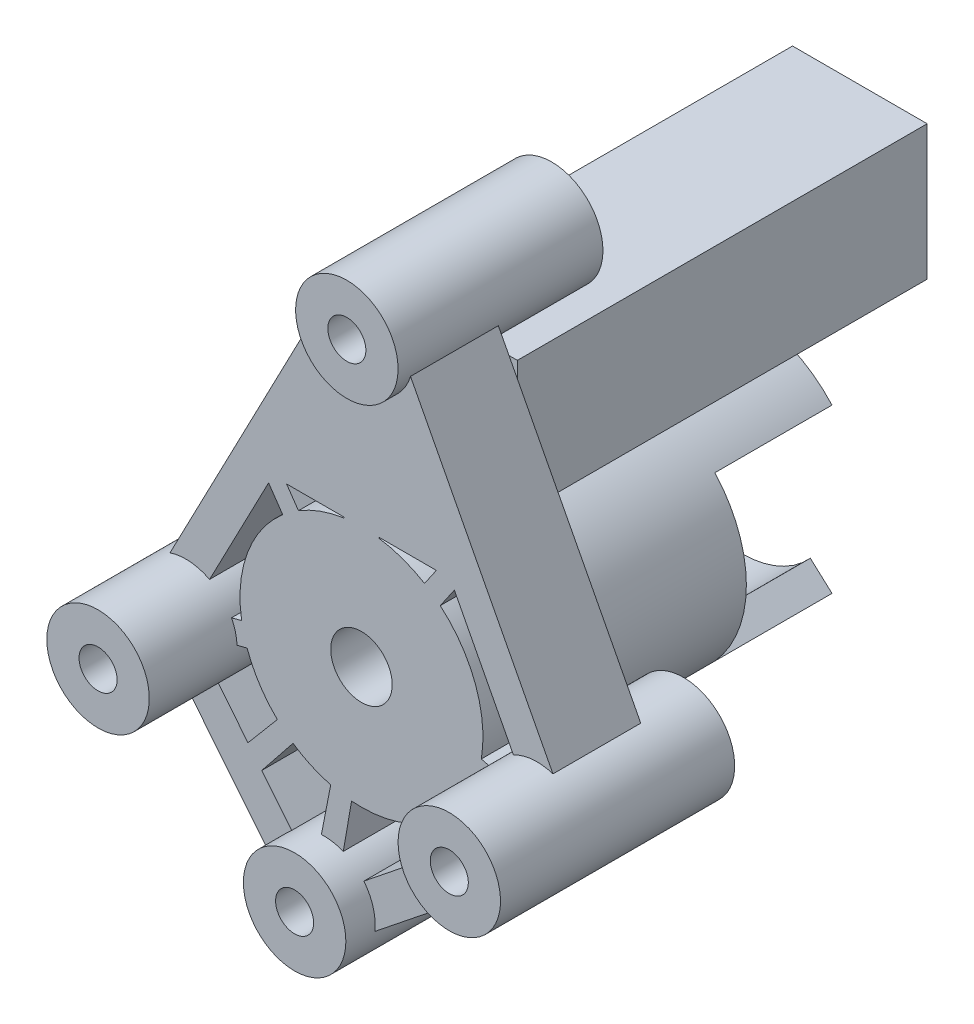
from build123d import *
from build123d.topology import SkipClean

# Parameters (mm, degrees)
SKETCH1_R                 = 0.6
SKETCH1_R_2               = 0.5
SKETCH1_R_3               = 1.05
BOSS_EXTRUDE7_DEPTH       = 3
BOSS_EXTRUDE8_DEPTH       = 3
BOSS_EXTRUDE13_DEPTH      = 3.5
BOSS_EXTRUDE13_DEPTH_BACK = 3.5
SKETCH3_R                 = 1.25
SKETCH3_R_2               = 0.6
BOSS_EXTRUDE14_START      = 2
SKETCH4_R                 = 3.497504757
SKETCH4_R_2               = 3.05
BOSS_EXTRUDE14_DEPTH      = 2
BOSS_EXTRUDE15_DEPTH      = 3
BOSS_EXTRUDE15_DEPTH_BACK = 5
SKETCH6_R                 = 1.25
SKETCH6_R_2               = 0.5
BOSS_EXTRUDE16_DEPTH      = 1
BOSS_EXTRUDE16_DEPTH_BACK = 5
SKETCH7_R                 = 1.25
SKETCH7_R_2               = 0.6
BOSS_EXTRUDE20_START      = -3
SKETCH10_R                = 3.839401525
SKETCH10_R_2              = 1.05
BOSS_EXTRUDE20_DEPTH      = 3
BOSS_EXTRUDE24_DEPTH      = 3.5
BOSS_EXTRUDE24_DEPTH_BACK = 3.5
SKETCH13_R                = 1.26
SKETCH13_R_2              = 0.6
BOSS_EXTRUDE25_START      = 4
SKETCH14_R                = 3.839401525
SKETCH14_R_2              = 3.05
BOSS_EXTRUDE25_DEPTH      = 4
SKETCH16_R                = 3.15
CUT_EXTRUDE1_DEPTH        = 10
SKETCH19_W                = 4.6
SKETCH19_H                = 4.6
SKETCH19_W_2              = 2.1
SKETCH19_H_2              = 2.1
BOSS_EXTRUDE30_DEPTH      = 14
BOSS_EXTRUDE31_DEPTH      = 3
BOSS_EXTRUDE32_DEPTH      = 6
BOSS_EXTRUDE32_DEPTH_BACK = 3
SKETCH21_R                = 4.15
SKETCH21_R_2              = 3.7
SKETCH23_R                = 0.65
SKETCH23_R_2              = 0.6
SKETCH23_R_3              = 0.5
CUT_EXTRUDE3_DEPTH        = 19.045223745
SKETCH24_R                = 1.75
SKETCH24_R_2              = 1.25
SKETCH24_R_3              = 1.26
BOSS_EXTRUDE34_DEPTH      = 8
SKETCH25_R                = 1.75
SKETCH25_R_2              = 1.26
BOSS_EXTRUDE35_DEPTH      = 2
CUT_EXTRUDE4_START        = -2.5
SKETCH28_R                = 1.75
SKETCH28_R_2              = 1.26
CUT_EXTRUDE4_DEPTH        = 2.5
SKETCH29_R                = 1.75
SKETCH29_R_2              = 1.25
CUT_EXTRUDE5_DEPTH        = 5.5
BOSS_EXTRUDE36_DEPTH      = 4


with BuildPart() as part:
    # Sketch1 → Boss-Extrude7 (new body)
    with BuildSketch(Plane.XY):
        with BuildLine():
            Line((7.108231058, 0.578207508), (1.108231058, 12.078207508))
            ThreePointArc((1.108231058, 12.078207508), (0, 12.75), (-1.108231058, 12.078207508))
            Line((-1.108231058, 12.078207508), (-7.108231058, 0.578207508))
            ThreePointArc((-7.108231058, 0.578207508), (-7.243810578, -0.124238663), (-6.971967562, -0.785989223))
            Line((-6.971967562, -0.785989223), (-2.256095038, -6.617716918))
            ThreePointArc((-2.256095038, -6.617716918), (-1.418670785, -7.074465841), (-0.502897209, -6.807524431))
            Line((-0.502897209, -6.807524431), (6.781230267, -0.975796736))
            ThreePointArc((6.781230267, -0.975796736), (7.223212296, -0.257394013), (7.108231058, 0.578207508))
        make_face()
        with BuildLine():
            Line((3.173462253, 5.417530683), (5.421792492, 1.108231058))
            ThreePointArc((5.421792492, 1.108231058), (5.151146176, 0.917576801), (4.940041034, 0.662560934))
            Line((4.940041034, 0.662560934), (3.460019455, 1.046730378))
            ThreePointArc((3.460019455, 1.046730378), (3.285676763, 2.756115163), (2.318317637, 4.176188415))
            Line((2.318317637, 4.176188415), (3.173462253, 5.417530683))
        make_face(mode=Mode.SUBTRACT)
        with BuildLine():
            Line((2.826537747, 6.082469317), (1.782346296, 4.56670349))
            ThreePointArc((1.782346296, 4.56670349), (1.213377036, 4.837703852), (0.605011738, 5.002199688))
            Line((0.605011738, 5.002199688), (0.593832634, 7.25))
            Line((0.593832634, 7.25), (-0.593832634, 7.25))
            Line((-0.593832634, 7.25), (-0.605011738, 5.002199688))
            ThreePointArc((-0.605011738, 5.002199688), (-1.213377036, 4.837703852), (-1.782346296, 4.56670349))
            Line((-1.782346296, 4.56670349), (-2.826537747, 6.082469317))
            Line((-2.826537747, 6.082469317), (-1.459602819, 8.702427929))
            Line((-1.459602819, 8.702427929), (-1.416591598, 10.248840282))
            Line((-1.416591598, 10.248840282), (-0.652452596, 10.249465858))
            Line((-0.652452596, 10.249465858), (-0.578207508, 10.391768942))
            ThreePointArc((-0.578207508, 10.391768942), (0, 10.25), (0.578207508, 10.391768942))
            Line((0.578207508, 10.391768942), (0.652452596, 10.249465858))
            Line((0.652452596, 10.249465858), (1.416591598, 10.248840282))
            Line((1.416591598, 10.248840282), (1.459602819, 8.702427929))
            Line((1.459602819, 8.702427929), (2.826537747, 6.082469317))
        make_face(mode=Mode.SUBTRACT)
        with Locations((0, 11.5)):
            Circle(SKETCH1_R, mode=Mode.SUBTRACT)
        with Locations((6, 0)):
            Circle(SKETCH1_R_2, mode=Mode.SUBTRACT)
        with BuildLine():
            Line((-5.421792492, 1.108231058), (-3.173462253, 5.417530683))
            Line((-3.173462253, 5.417530683), (-2.318317637, 4.176188415))
            ThreePointArc((-2.318317637, 4.176188415), (-3.285676763, 2.756115163), (-3.460019455, 1.046730378))
            Line((-3.460019455, 1.046730378), (-4.940041034, 0.662560934))
            ThreePointArc((-4.940041034, 0.662560934), (-5.151146176, 0.917576801), (-5.421792492, 1.108231058))
        make_face(mode=Mode.SUBTRACT)
        with BuildLine():
            Line((2.065197241, -3.150232928), (-0.30833074, -5.050497428))
            ThreePointArc((-0.30833074, -5.050497428), (-0.49210351, -4.864671318), (-0.710499145, -4.721119511))
            Line((-0.710499145, -4.721119511), (-0.225925805, -1.932779162))
            ThreePointArc((-0.225925805, -1.932779162), (0.553480724, -1.89601189), (1.305339934, -1.687363629))
            Line((1.305339934, -1.687363629), (2.065197241, -3.150232928))
        make_face(mode=Mode.SUBTRACT)
        with BuildLine():
            Line((5.024203264, -0.781230267), (2.650675283, -2.681494768))
            Line((2.650675283, -2.681494768), (1.955184546, -1.342543312))
            ThreePointArc((1.955184546, -1.342543312), (2.741798836, -0.614002206), (3.270756776, 0.318595072))
            Line((3.270756776, 0.318595072), (4.750934565, -0.048327426))
            ThreePointArc((4.750934565, -0.048327426), (4.828765795, -0.436704061), (5.024203264, -0.781230267))
        make_face(mode=Mode.SUBTRACT)
        with BuildLine():
            ThreePointArc((-1.930451643, -1.359065941), (-1.446591891, -1.626901774), (-0.926562281, -1.815118396))
            Line((-0.926562281, -1.815118396), (-1.468660161, -4.595423652))
            ThreePointArc((-1.468660161, -4.595423652), (-1.787065481, -4.687370512), (-2.070116699, -4.859760133))
            Line((-2.070116699, -4.859760133), (-3.406266971, -3.207454116))
            Line((-3.406266971, -3.207454116), (-1.930451643, -1.359065941))
        make_face(mode=Mode.SUBTRACT)
        with BuildLine():
            ThreePointArc((-3.270756776, 0.318595072), (-2.929706535, -0.352908606), (-2.452803504, -0.935828803))
            Line((-2.452803504, -0.935828803), (-3.877860505, -2.624273579))
            Line((-3.877860505, -2.624273579), (-5.214010777, -0.971967562))
            ThreePointArc((-5.214010777, -0.971967562), (-4.882574548, -0.560232416), (-4.750934565, -0.048327426))
            Line((-4.750934565, -0.048327426), (-3.270756776, 0.318595072))
        make_face(mode=Mode.SUBTRACT)
        with Locations((-6, 0)):
            Circle(SKETCH1_R_2, mode=Mode.SUBTRACT)
        with Locations((-1.284127476, -5.831727695)):
            Circle(SKETCH1_R, mode=Mode.SUBTRACT)
        with Locations((0, 1.557420984)):
            Circle(SKETCH1_R_3, mode=Mode.SUBTRACT)
    extrude(amount=BOSS_EXTRUDE7_DEPTH)

    # Sketch1<8> → Boss-Extrude8 (add)
    with BuildSketch(Plane.XY):
        with BuildLine():
            Line((0.652452596, 10.249465858), (0.578207508, 10.391768942))
            ThreePointArc((0.578207508, 10.391768942), (0, 10.25), (-0.578207508, 10.391768942))
            Line((-0.578207508, 10.391768942), (-0.652452596, 10.249465858))
            Line((-0.652452596, 10.249465858), (-1.416591598, 10.248840282))
            Line((-1.416591598, 10.248840282), (-1.459602819, 8.702427929))
            Line((-1.459602819, 8.702427929), (-2.217391304, 7.25))
            Line((-2.217391304, 7.25), (2.217391304, 7.25))
            Line((2.217391304, 7.25), (1.459602819, 8.702427929))
            Line((1.459602819, 8.702427929), (1.416591598, 10.248840282))
            Line((1.416591598, 10.248840282), (0.652452596, 10.249465858))
        make_face()
    extrude(amount=BOSS_EXTRUDE8_DEPTH)

    # Sketch4 → Boss-Extrude14 (add)
    with SkipClean():  # the faces are left unmerged after this step: merging them gives an invalid solid
        with BuildSketch(Plane(origin=(0, 0, 0), x_dir=(-1, 0, 0), z_dir=(0, 0, -1)).offset(BOSS_EXTRUDE14_START)):
            with Locations((0, 1.557420984)):
                Circle(SKETCH4_R)
            with Locations((0, 1.557420984)):
                Circle(SKETCH4_R_2, mode=Mode.SUBTRACT)
        extrude(amount=-BOSS_EXTRUDE14_DEPTH)

    # Sketch6 → Boss-Extrude15 (add, two sides: drawn at the far end of the back side and taken through both)
    # profile 1 of 2: a face of its own
    with SkipClean():  # the faces are left unmerged after this step: merging them gives an invalid solid
        with BuildSketch(Plane.XY.offset(3).offset(-BOSS_EXTRUDE15_DEPTH_BACK)):
            with Locations((-6, 0)):
                Circle(SKETCH6_R)
            with Locations((-6, 0)):
                Circle(SKETCH6_R_2, mode=Mode.SUBTRACT)
        # profile 2 of 2: a face of its own
        with BuildSketch(Plane.XY.offset(3).offset(-BOSS_EXTRUDE15_DEPTH_BACK)):
            with Locations((6, 0)):
                Circle(SKETCH6_R)
            with Locations((6, 0)):
                Circle(SKETCH6_R_2, mode=Mode.SUBTRACT)
        extrude(amount=BOSS_EXTRUDE15_DEPTH + BOSS_EXTRUDE15_DEPTH_BACK)

    # Sketch7 → Boss-Extrude16 (add, two sides: drawn at the far end of the back side and taken through both)
    with SkipClean():  # the faces are left unmerged after this step: merging them gives an invalid solid
        with BuildSketch(Plane.XY.offset(3).offset(-BOSS_EXTRUDE16_DEPTH_BACK)):
            with Locations((-1.284127476, -5.831727695)):
                Circle(SKETCH7_R)
            with Locations((-1.284127476, -5.831727695)):
                Circle(SKETCH7_R_2, mode=Mode.SUBTRACT)
        extrude(amount=BOSS_EXTRUDE16_DEPTH + BOSS_EXTRUDE16_DEPTH_BACK)

    # Sketch10 → Boss-Extrude20 (add)
    with SkipClean():  # the faces are left unmerged after this step: merging them gives an invalid solid
        with BuildSketch(Plane.XY.offset(3).offset(BOSS_EXTRUDE20_START)):
            with Locations((0, 1.557420984)):
                Circle(SKETCH10_R)
            with Locations((0, 1.557420984)):
                Circle(SKETCH10_R_2, mode=Mode.SUBTRACT)
        extrude(amount=BOSS_EXTRUDE20_DEPTH)



with BuildPart() as body_2:
    # Sketch3 → Boss-Extrude13 (new, two sides: drawn at the far end of the back side and taken through both)
    with BuildSketch(Plane(origin=(0, 0, 0), x_dir=(-1, 0, 0), z_dir=(0, 0, -1)).offset(-BOSS_EXTRUDE13_DEPTH_BACK)):
        with Locations((0, 11.5)):
            Circle(SKETCH3_R)
        with Locations((0, 11.5)):
            Circle(SKETCH3_R_2, mode=Mode.SUBTRACT)
    extrude(amount=BOSS_EXTRUDE13_DEPTH + BOSS_EXTRUDE13_DEPTH_BACK)


with BuildPart() as part_1:
    with SkipClean():  # the faces are left unmerged after this step: merging them gives an invalid solid
        add(part.part)

        add(body_2.part)  # Boss-Extrude24 merges body 2
        # Sketch13 → Boss-Extrude24 (add, two sides: drawn at the far end of the back side and taken through both)
        with BuildSketch(Plane(origin=(0, 0, 0), x_dir=(-1, 0, 0), z_dir=(0, 0, -1)).offset(-BOSS_EXTRUDE24_DEPTH_BACK)):
            with Locations((0, 11.5)):
                Circle(SKETCH13_R)
            with Locations((0, 11.5)):
                Circle(SKETCH13_R_2, mode=Mode.SUBTRACT)
        extrude(amount=BOSS_EXTRUDE24_DEPTH + BOSS_EXTRUDE24_DEPTH_BACK)

    # Sketch14 → Boss-Extrude25 (add)
    with SkipClean():  # the faces are left unmerged after this step: merging them gives an invalid solid
        with BuildSketch(Plane(origin=(0, 0, -2), x_dir=(-1, 0, 0), z_dir=(0, 0, -1)).offset(BOSS_EXTRUDE25_START)):
            with Locations((0, 1.557420984)):
                Circle(SKETCH14_R)
            with Locations((0, 1.557420984)):
                Circle(SKETCH14_R_2, mode=Mode.SUBTRACT)
        extrude(amount=-BOSS_EXTRUDE25_DEPTH)

    # Sketch16 → Cut-Extrude1 (cut)
    with SkipClean():  # the faces are left unmerged after this step: merging them gives an invalid solid
        with BuildSketch(Plane(origin=(0, 0, 0), x_dir=(-1, 0, 0), z_dir=(0, 0, -1))):
            with Locations((0, 1.557420984)):
                Circle(SKETCH16_R)
        extrude(amount=CUT_EXTRUDE1_DEPTH, mode=Mode.SUBTRACT)

    # Sketch19 → Boss-Extrude30 (add)
    with SkipClean():  # the faces are left unmerged after this step: merging them gives an invalid solid
        with BuildSketch(Plane(origin=(0, 0, 0), x_dir=(-1, 0, 0), z_dir=(0, 0, -1))):
            with Locations((-0.026819917, 7.993639834)):
                Rectangle(SKETCH19_W, SKETCH19_H)
            with Locations((0, 7.966819917)):
                Rectangle(SKETCH19_W_2, SKETCH19_H_2, mode=Mode.SUBTRACT)
        extrude(amount=BOSS_EXTRUDE30_DEPTH)

    # Sketch20 → Boss-Extrude31 (add)
    with SkipClean():  # the faces are left unmerged after this step: merging them gives an invalid solid
        with BuildSketch(Plane.XY.offset(3)):
            Polygon((0.593832634, 7.25), (0.601572962, 5.693639834), (2.558678151, 5.693639834), (2.826537747, 6.082469317), (2.217391304, 7.25), align=None)
            Polygon((-2.826537747, 6.082469317), (-2.558678151, 5.693639834), (-0.601572962, 5.693639834), (-0.593832634, 7.25), (-2.217391304, 7.25), align=None)
        extrude(amount=-BOSS_EXTRUDE31_DEPTH)

    # Sketch21 → Boss-Extrude32 (add, two sides: drawn at the far end of the back side and taken through both)
    with SkipClean():  # the faces are left unmerged after this step: merging them gives an invalid solid
        with BuildSketch(Plane(origin=(0, 0, 0), x_dir=(-1, 0, 0), z_dir=(0, 0, -1)).offset(-BOSS_EXTRUDE32_DEPTH_BACK)):
            with Locations((0, 1.557420984)):
                Circle(SKETCH21_R)
            with Locations((0, 1.557420984)):
                Circle(SKETCH21_R_2, mode=Mode.SUBTRACT)
        extrude(amount=BOSS_EXTRUDE32_DEPTH + BOSS_EXTRUDE32_DEPTH_BACK)

    # Sketch23 → Cut-Extrude3 (cut, through all)
    # profile 1 of 4: a face of its own
    with SkipClean():  # the faces are left unmerged after this step: merging them gives an invalid solid
        with BuildSketch(Plane(origin=(0, 0, -3.5), x_dir=(-1, 0, 0), z_dir=(0, 0, -1))):
            with Locations((0, 11.5)):
                Circle(SKETCH23_R)
            with Locations((0, 11.5)):
                Circle(SKETCH23_R_2, mode=Mode.SUBTRACT)
        # profile 2 of 4: a face of its own
        with BuildSketch(Plane(origin=(0, 0, -3.5), x_dir=(-1, 0, 0), z_dir=(0, 0, -1))):
            with Locations((-6, 0)):
                Circle(SKETCH23_R)
            with Locations((-6, 0)):
                Circle(SKETCH23_R_3, mode=Mode.SUBTRACT)
        # profile 3 of 4: a face of its own
        with BuildSketch(Plane(origin=(0, 0, -3.5), x_dir=(-1, 0, 0), z_dir=(0, 0, -1))):
            with Locations((1.284127476, -5.831727695)):
                Circle(SKETCH23_R)
            with Locations((1.284127476, -5.831727695)):
                Circle(SKETCH23_R_2, mode=Mode.SUBTRACT)
        # profile 4 of 4: a face of its own
        with BuildSketch(Plane(origin=(0, 0, -3.5), x_dir=(-1, 0, 0), z_dir=(0, 0, -1))):
            with Locations((6, 0)):
                Circle(SKETCH23_R)
            with Locations((6, 0)):
                Circle(SKETCH23_R_3, mode=Mode.SUBTRACT)
        extrude(amount=-CUT_EXTRUDE3_DEPTH, mode=Mode.SUBTRACT)

    # Sketch24 → Boss-Extrude34 (add)
    # profile 1 of 4: a face of its own
    with BuildSketch(Plane(origin=(0, 0, -2), x_dir=(-1, 0, 0), z_dir=(0, 0, -1))):
        with Locations((-6, 0)):
            Circle(SKETCH24_R)
        with Locations((-6, 0)):
            Circle(SKETCH24_R_2, mode=Mode.SUBTRACT)
    # profile 2 of 4: a face of its own
    with BuildSketch(Plane(origin=(0, 0, -2), x_dir=(-1, 0, 0), z_dir=(0, 0, -1))):
        with Locations((0, 11.5)):
            Circle(SKETCH24_R)
        with Locations((0, 11.5)):
            Circle(SKETCH24_R_3, mode=Mode.SUBTRACT)
    # profile 3 of 4: a face of its own
    with BuildSketch(Plane(origin=(0, 0, -2), x_dir=(-1, 0, 0), z_dir=(0, 0, -1))):
        with Locations((6, 0)):
            Circle(SKETCH24_R)
        with Locations((6, 0)):
            Circle(SKETCH24_R_2, mode=Mode.SUBTRACT)
    # profile 4 of 4: a face of its own
    with BuildSketch(Plane(origin=(0, 0, -2), x_dir=(-1, 0, 0), z_dir=(0, 0, -1))):
        with Locations((1.284127476, -5.831727695)):
            Circle(SKETCH24_R)
        with Locations((1.284127476, -5.831727695)):
            Circle(SKETCH24_R_2, mode=Mode.SUBTRACT)
    extrude(amount=-BOSS_EXTRUDE34_DEPTH)

    # Sketch25 → Boss-Extrude35 (add)
    with BuildSketch(Plane(origin=(0, 0, -3.5), x_dir=(-1, 0, 0), z_dir=(0, 0, -1))):
        with Locations((0, 11.5)):
            Circle(SKETCH25_R)
        with Locations((0, 11.5)):
            Circle(SKETCH25_R_2, mode=Mode.SUBTRACT)
    extrude(amount=-BOSS_EXTRUDE35_DEPTH)

    # Sketch28 → Cut-Extrude4 (cut)
    with BuildSketch(Plane.XY.offset(6).offset(CUT_EXTRUDE4_START)):
        with Locations((0, 11.5)):
            Circle(SKETCH28_R)
        with Locations((0, 11.5)):
            Circle(SKETCH28_R_2, mode=Mode.SUBTRACT)
    extrude(amount=CUT_EXTRUDE4_DEPTH, mode=Mode.SUBTRACT)

    # Sketch29 → Cut-Extrude5 (cut)
    with BuildSketch(Plane.XY.offset(4)):
        with Locations((-1.284127476, -5.831727695)):
            Circle(SKETCH29_R)
        with Locations((-1.284127476, -5.831727695)):
            Circle(SKETCH29_R_2, mode=Mode.SUBTRACT)
    extrude(amount=CUT_EXTRUDE5_DEPTH, mode=Mode.SUBTRACT)

    # Sketch30 → Boss-Extrude36 (add)
    with BuildSketch(Plane(origin=(0, 0, -6), x_dir=(-1, 0, 0), z_dir=(0, 0, -1))):
        with BuildLine():
            ThreePointArc((-0.33792547, 5.693639834), (-1.835635989, 5.279374841), (-3.075973525, 4.343257819))
            Line((-3.075973525, 4.343257819), (-2.334775085, 3.671971835))
            ThreePointArc((-2.334775085, 3.671971835), (0, 4.707420984), (2.334775085, 3.671971835))
            Line((2.334775085, 3.671971835), (3.075973525, 4.343257819))
            ThreePointArc((3.075973525, 4.343257819), (1.835635989, 5.279374841), (0.33792547, 5.693639834))
            Line((0.33792547, 5.693639834), (-0.33792547, 5.693639834))
        make_face()
        with BuildLine():
            Line((-2.334775085, -0.557129868), (-3.075973525, -1.228415852))
            ThreePointArc((-3.075973525, -1.228415852), (0, -2.592579016), (3.075973525, -1.228415852))
            Line((3.075973525, -1.228415852), (2.334775085, -0.557129868))
            ThreePointArc((2.334775085, -0.557129868), (0, -1.592579016), (-2.334775085, -0.557129868))
        make_face()
    extrude(amount=BOSS_EXTRUDE36_DEPTH)


solid = part_1.part
